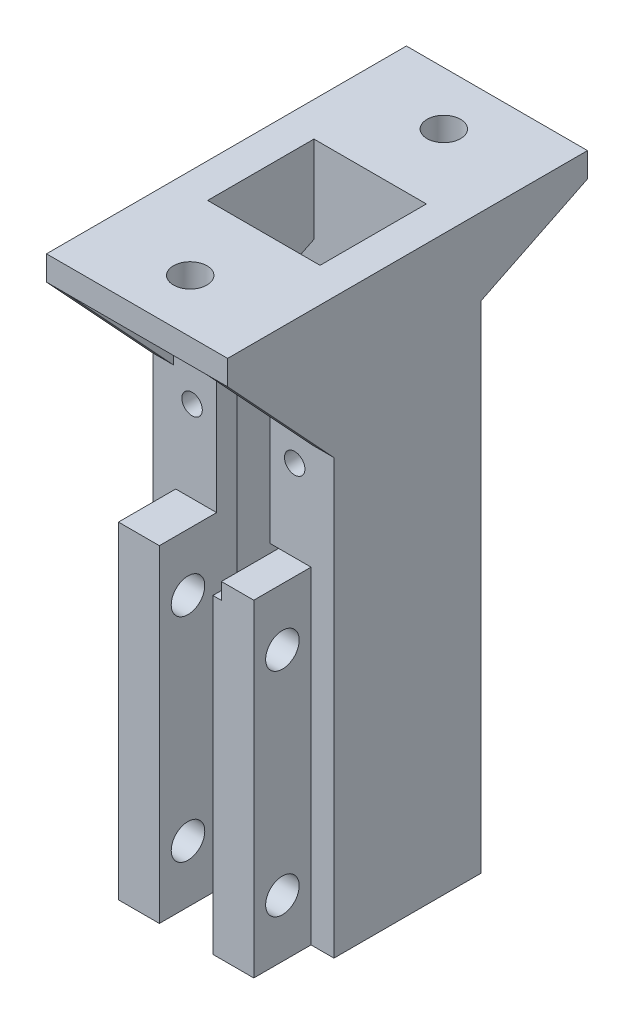
from build123d import *

# Parameters (mm, degrees)
BOSS_EXTRUDE1_DEPTH      = 40
SKETCH3_R                = 2.05
CUT_EXTRUDE2_DEPTH       = 40
BOSS_EXTRUDE11_DEPTH     = 30
SKETCH7_W                = 4.5
SKETCH7_H                = 2
CUT_EXTRUDE3_DEPTH       = 76.944893498
SKETCH10_W               = 4.5
SKETCH10_H               = 75
CUT_EXTRUDE5_DEPTH       = 1.5
SKETCH16_R               = 1.25
CUT_EXTRUDE9_DEPTH       = 3.5
SKETCH17_R               = 1.25
CUT_EXTRUDE10_DEPTH      = 3.5
SKETCH18_W               = 22.143059905
SKETCH18_H               = 3
BOSS_EXTRUDE4_DEPTH      = 15.5
BOSS_EXTRUDE5_DEPTH      = 13
BOSS_EXTRUDE5_DEPTH_BACK = 2
SKETCH19_W               = 22.143059905
SKETCH19_H               = 3
BOSS_EXTRUDE6_DEPTH      = 2.5
BOSS_EXTRUDE8_DEPTH      = 2.5
BOSS_EXTRUDE9_DEPTH      = 4.2
BOSS_EXTRUDE10_DEPTH     = 4.2
SKETCH25_R               = 2.05
CUT_EXTRUDE12_DEPTH      = 3.5


with BuildPart() as part:
    # Sketch2 → Boss-Extrude1 (new body)
    with BuildSketch(Plane(origin=(0, 0, 0), x_dir=(1, 0, 0), z_dir=(0, 1, 0))):
        Polygon((-15.576483829, 2.342750264), (-15.576483829, -15.657249736), (-12.776483829, -15.657249736), (-12.776483829, -22.657249736), (-7.776483829, -22.657249736), (-7.776483829, -13.157249736), (-13.076483829, -13.157249736), (-13.076483829, -0.157249736), (4.066576076, -0.157249736), (4.066576076, -13.157249736), (-1.233423924, -13.157249736), (-1.233423924, -22.657249736), (3.766576076, -22.657249736), (3.766576076, -15.657249736), (6.566576076, -15.657249736), (6.566576076, 2.342750264), align=None)
    extrude(amount=BOSS_EXTRUDE1_DEPTH)

    # Sketch3 → Cut-Extrude2 (cut)
    with BuildSketch(Plane.ZY.offset(12.776483829)):
        with Locations((19.157249736, 33)):
            Circle(SKETCH3_R)
        with Locations((19.157249736, 7)):
            Circle(SKETCH3_R)
    extrude(amount=-CUT_EXTRUDE2_DEPTH, mode=Mode.SUBTRACT)

    # Sketch26 → Boss-Extrude11 (add)
    with BuildSketch(Plane(origin=(0, 40, 0), x_dir=(1, 0, 0), z_dir=(0, 1, 0))):
        Polygon((-1.233423924, -15.657249736), (3.766576076, -15.657249736), (6.566576076, -15.657249736), (6.566576076, 2.342750264), (-15.576483829, 2.342750264), (-15.576483829, -15.657249736), (-12.776483829, -15.657249736), (-7.776483829, -15.657249736), (-7.776483829, -13.157249736), (-13.076483829, -13.157249736), (-13.076483829, -0.157249736), (4.066576076, -0.157249736), (4.066576076, -13.157249736), (-1.233423924, -13.157249736), align=None)
    extrude(amount=BOSS_EXTRUDE11_DEPTH)

    # Sketch7 → Cut-Extrude3 (cut, through all)
    with BuildSketch(Plane(origin=(0, 0, -2.342750264), x_dir=(-1, 0, 0), z_dir=(0, 0, -1))):
        with Locations((2.443423924, 39)):
            Rectangle(SKETCH7_W, SKETCH7_H)
    extrude(amount=-CUT_EXTRUDE3_DEPTH, mode=Mode.SUBTRACT)

    # Sketch10 → Cut-Extrude5 (cut)
    with BuildSketch(Plane(origin=(0, 0, -2.342750264), x_dir=(-1, 0, 0), z_dir=(0, 0, -1))):
        with Locations((2.443423924, 77.5)):
            Rectangle(SKETCH10_W, SKETCH10_H)
    extrude(amount=-CUT_EXTRUDE5_DEPTH, mode=Mode.SUBTRACT)

    # Sketch16 → Cut-Extrude9 (cut)
    with BuildSketch(Plane.XY.offset(15.657249736)):
        with Locations((-10.776483829, 50)):
            Circle(SKETCH16_R)
    extrude(amount=-CUT_EXTRUDE9_DEPTH, mode=Mode.SUBTRACT)

    # Sketch17 → Cut-Extrude10 (cut)
    with BuildSketch(Plane.XY.offset(15.657249736)):
        with Locations((1.766576076, 50)):
            Circle(SKETCH17_R)
    extrude(amount=-CUT_EXTRUDE10_DEPTH, mode=Mode.SUBTRACT)

    # Sketch18 → Boss-Extrude4 (add)
    with BuildSketch(Plane(origin=(0, 0, 13.157249736), x_dir=(-1, 0, 0), z_dir=(0, 0, -1))):
        with Locations((4.504953877, 68.5)):
            Rectangle(SKETCH18_W, SKETCH18_H)
    extrude(amount=-BOSS_EXTRUDE4_DEPTH)

    # Sketch19 → Boss-Extrude5 (add, two sides: drawn at the far end of the back side and taken through both)
    with BuildSketch(Plane(origin=(0, 0, -2.342750264), x_dir=(-1, 0, 0), z_dir=(0, 0, -1)).offset(-BOSS_EXTRUDE5_DEPTH_BACK)):
        with Locations((4.504953877, 68.5)):
            Rectangle(SKETCH19_W, SKETCH19_H)
    extrude(amount=BOSS_EXTRUDE5_DEPTH + BOSS_EXTRUDE5_DEPTH_BACK)

    # Sketch21 → Boss-Extrude6 (add)
    with BuildSketch(Plane.ZY.offset(15.576483829)):
        Polygon((28.657249736, 67), (15.657249736, 53), (15.657249736, 67), align=None)
    extrude(amount=-BOSS_EXTRUDE6_DEPTH)

    # Sketch22 → Boss-Extrude8 (add)
    with BuildSketch(Plane(origin=(6.566576076, 0, 0), x_dir=(0, 0, -1), z_dir=(1, 0, 0))):
        Polygon((-28.657249736, 67), (-15.657249736, 67), (-15.657249736, 53), align=None)
    extrude(amount=-BOSS_EXTRUDE8_DEPTH)

    # Sketch23 → Boss-Extrude9 (add)
    with BuildSketch(Plane(origin=(6.566576076, 0, 0), x_dir=(0, 0, -1), z_dir=(1, 0, 0))):
        Polygon((-13.157249736, 70), (-13.157249736, 53), (15.342750264, 67), (15.342750264, 70), align=None)
    extrude(amount=-BOSS_EXTRUDE9_DEPTH)

    # Sketch24 → Boss-Extrude10 (add)
    with BuildSketch(Plane.ZY.offset(15.576483829)):
        Polygon((13.157249736, 70), (-15.342750264, 70), (-15.342750264, 67), (13.157249736, 53), align=None)
    extrude(amount=-BOSS_EXTRUDE10_DEPTH)

    # Sketch25 → Cut-Extrude12 (cut)
    with BuildSketch(Plane(origin=(0, 70, 0), x_dir=(1, 0, 0), z_dir=(0, 1, 0))):
        with Locations((-4.504953829, 8.842750264)):
            Circle(SKETCH25_R)
        with Locations((-4.504953767, -22.157249736)):
            Circle(SKETCH25_R)
    extrude(amount=-CUT_EXTRUDE12_DEPTH, mode=Mode.SUBTRACT)


solid = part.part
